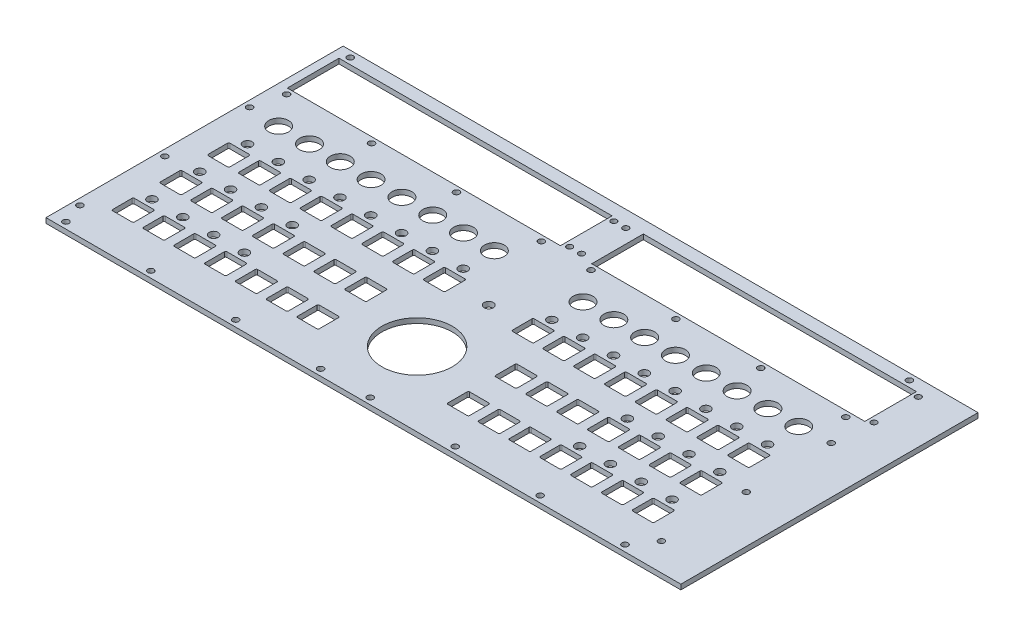
from build123d import *

# Parameters (mm, degrees)
SKETCH1_W              = 379.857
SKETCH1_H              = 177.8
BOSS_EXTRUDE1_DEPTH    = 2.999994
SKETCH2_R              = 5.92074
SKETCH2_W              = 163.40074
SKETCH2_H              = 30.8991
CUT_EXTRUDE1_DEPTH     = 10.16
CUT_EXTRUDE2_DEPTH     = 50.8
SKETCH6_R              = 2.667
CUT_EXTRUDE3_DEPTH     = 50.8
LPATTERN1_COUNT        = 8
LPATTERN1_PITCH        = 18.4375044
LPATTERN1_COUNT_DIR2   = 3
LPATTERN1_PITCH_DIR2   = 28.575
LPATTERN2_COUNT        = 8
LPATTERN2_PITCH        = 18.4375044
LPATTERN2_COUNT_DIR2   = 3
LPATTERN2_PITCH_DIR2   = 28.575
SKETCH7_W              = 12.9999994
SKETCH7_H              = 12.9999994
CUT_EXTRUDE4_DEPTH     = 5.08
FILLET1_R              = 0.7493
FILLET2_R              = 0.7493
LPATTERN3_COUNT        = 8
LPATTERN3_PITCH        = 18.4375044
LPATTERN3_COUNT_DIR2   = 3
LPATTERN3_PITCH_DIR2   = 28.575
FILLET1_OF_LPATTERN3_R = 0.7493
FILLET2_OF_LPATTERN3_R = 0.7493
SKETCH9_R              = 21.06168
CUT_EXTRUDE6_DEPTH     = 5.08
SKETCH10_R             = 2.667
CUT_EXTRUDE7_DEPTH     = 5.08
LPATTERN4_COUNT        = 8
LPATTERN4_PITCH        = 18.4375044
LPATTERN4_COUNT_DIR2   = 3
LPATTERN4_PITCH_DIR2   = 28.575
SKETCH11_R             = 2.7499945
CUT_EXTRUDE8_DEPTH     = 5.08
SKETCH12_R             = 1.8288
CUT_EXTRUDE9_DEPTH     = 5.08
LPATTERN5_COUNT        = 4
LPATTERN5_PITCH        = 50.8
SKETCH13_R             = 1.8288
CUT_EXTRUDE10_DEPTH    = 5.08
LPATTERN6_COUNT        = 4
LPATTERN6_PITCH        = 50.8
LPATTERN6_COUNT_DIR2   = 2
LPATTERN6_PITCH_DIR2   = 38.1
SKETCH14_R             = 1.8288
CUT_EXTRUDE11_DEPTH    = 5.08
LPATTERN7_COUNT        = 3
LPATTERN7_PITCH        = 50.8
SKETCH15_R             = 1.8288
CUT_EXTRUDE12_DEPTH    = 5.08
LPATTERN8_COUNT        = 4
LPATTERN8_PITCH        = 50.8
SKETCH16_R             = 1.8288
CUT_EXTRUDE13_DEPTH    = 5.08
LPATTERN9_COUNT        = 4
LPATTERN9_PITCH        = 50.8
LPATTERN9_COUNT_DIR2   = 2
LPATTERN9_PITCH_DIR2   = 38.1
SKETCH17_R             = 1.8288
CUT_EXTRUDE14_DEPTH    = 5.08
LPATTERN10_COUNT       = 3
LPATTERN10_PITCH       = 50.8
SKETCH19_R             = 1.75
SKETCH19_R_2           = 1.7292972
SKETCH19_R_3           = 1.725593959
CUT_EXTRUDE15_DEPTH    = 10


with BuildPart() as part:
    # Sketch1 → Boss-Extrude1 (new body)
    with BuildSketch(Plane(origin=(0, 0, 0), x_dir=(1, 0, 0), z_dir=(0, 1, 0))):
        with Locations((148.119960524, -55.488902214)):
            Rectangle(SKETCH1_W, SKETCH1_H)
    extrude(amount=BOSS_EXTRUDE1_DEPTH)

    # Sketch2 → Cut-Extrude1 (cut)
    with BuildSketch(Plane(origin=(0, 2.999994, 0), x_dir=(1, 0, 0), z_dir=(0, 1, 0))):
        with Locations(Location((-19.596239476, -27.399042214, 0), (0, 0, 270))):
            Circle(SKETCH2_R)
        with Locations(Location((-1.158379476, -27.399042214, 0), (0, 0, 270))):
            Circle(SKETCH2_R)
        with Locations(Location((17.279480524, -27.399042214, 0), (0, 0, 270))):
            Circle(SKETCH2_R)
        with Locations(Location((35.717340524, -27.399042214, 0), (0, 0, 270))):
            Circle(SKETCH2_R)
        with Locations(Location((54.155200524, -27.399042214, 0), (0, 0, 270))):
            Circle(SKETCH2_R)
        with Locations(Location((72.593060524, -27.399042214, 0), (0, 0, 270))):
            Circle(SKETCH2_R)
        with Locations(Location((91.030920524, -27.399042214, 0), (0, 0, 270))):
            Circle(SKETCH2_R)
        with Locations(Location((109.468780524, -27.399042214, 0), (0, 0, 270))):
            Circle(SKETCH2_R)
        with Locations(Location((291.586780524, -27.399042214, 0), (0, 0, 270))):
            Circle(SKETCH2_R)
        with Locations(Location((273.148920524, -27.399042214, 0), (0, 0, 270))):
            Circle(SKETCH2_R)
        with Locations(Location((254.711060524, -27.399042214, 0), (0, 0, 270))):
            Circle(SKETCH2_R)
        with Locations(Location((236.273200524, -27.399042214, 0), (0, 0, 270))):
            Circle(SKETCH2_R)
        with Locations(Location((217.835340524, -27.399042214, 0), (0, 0, 270))):
            Circle(SKETCH2_R)
        with Locations(Location((199.397480524, -27.399042214, 0), (0, 0, 270))):
            Circle(SKETCH2_R)
        with Locations(Location((180.959620524, -27.399042214, 0), (0, 0, 270))):
            Circle(SKETCH2_R)
        with Locations(Location((162.521760524, -27.399042214, 0), (0, 0, 270))):
            Circle(SKETCH2_R)
        with Locations((44.932968524, 10.422827786)):
            Rectangle(SKETCH2_W, SKETCH2_H)
        with Locations((227.050968524, 10.422827786)):
            Rectangle(SKETCH2_W, SKETCH2_H)
    extrude(amount=-CUT_EXTRUDE1_DEPTH, mode=Mode.SUBTRACT)

    # Sketch4 → Cut-Extrude2 (cut)
    with BuildSketch(Plane(origin=(0, 2.999994, 0), x_dir=(1, 0, 0), z_dir=(0, 1, 0))):
        with BuildLine():
            Line((-25.346238136, -50.779602514), (-13.846240816, -50.779602514))
            ThreePointArc((-13.846240816, -50.779602514), (-13.315909995, -50.999272732), (-13.096239776, -51.529603554))
            Line((-13.096239776, -51.529603554), (-13.096239776, -63.029600874))
            ThreePointArc((-13.096239776, -63.029600874), (-13.315909995, -63.559931695), (-13.846240816, -63.779601914))
            Line((-13.846240816, -63.779601914), (-25.346238136, -63.779601914))
            ThreePointArc((-25.346238136, -63.779601914), (-25.876568957, -63.559931695), (-26.096239176, -63.029600874))
            Line((-26.096239176, -63.029600874), (-26.096239176, -51.529603554))
            ThreePointArc((-26.096239176, -51.529603554), (-25.876568957, -50.999272732), (-25.346238136, -50.779602514))
        make_face()
    cut_extrude2 = extrude(amount=-CUT_EXTRUDE2_DEPTH, mode=Mode.SUBTRACT)

    # Sketch6 → Cut-Extrude3 (cut)
    with BuildSketch(Plane(origin=(0, 2.999994, 0), x_dir=(1, 0, 0), z_dir=(0, 1, 0))):
        with Locations(Location((-19.596239476, -46.040102214, 0), (0, 0, 270))):
            Circle(SKETCH6_R)
    cut_extrude3 = extrude(amount=-CUT_EXTRUDE3_DEPTH, mode=Mode.SUBTRACT)

    # LPattern1: Cut-Extrude3 8 × 3, 8 skipped
    with Locations(*[(i * LPATTERN1_PITCH, 0, j * LPATTERN1_PITCH_DIR2) for i in range(LPATTERN1_COUNT) for j in range(LPATTERN1_COUNT_DIR2) if (i, j) not in ((0, 0), (4, 1), (4, 2), (5, 1), (5, 2), (6, 1), (6, 2), (7, 1), (7, 2))]):
        add(cut_extrude3, mode=Mode.SUBTRACT)

    # LPattern2: Cut-Extrude2 8 × 3, 2 skipped
    with Locations(*[(i * LPATTERN2_PITCH, 0, j * LPATTERN2_PITCH_DIR2) for i in range(LPATTERN2_COUNT) for j in range(LPATTERN2_COUNT_DIR2) if (i, j) not in ((0, 0), (7, 1), (7, 2))]):
        add(cut_extrude2, mode=Mode.SUBTRACT)

    # Sketch7 → Cut-Extrude4 (cut)
    with BuildSketch(Plane(origin=(0, 2.999994, 0), x_dir=(1, 0, 0), z_dir=(0, 1, 0))):
        with Locations((291.586780524, -57.279741914)):
            Rectangle(SKETCH7_W, SKETCH7_H)
    cut_extrude4 = extrude(amount=-CUT_EXTRUDE4_DEPTH, mode=Mode.SUBTRACT)

    # Fillet1
    fillet1_edges = [part.edges().sort_by_distance(p)[0] for p in [
        (285.086780824, 1.499997, 50.779742214),
    ]]
    fillet(fillet1_edges, radius=FILLET1_R)

    # Fillet2
    fillet2_edges = [part.edges().sort_by_distance(p)[0] for p in [
        (285.086780824, 1.499997, 63.779741614),
        (298.086780224, 1.499997, 50.779742214),
        (298.086780224, 1.499997, 63.779741614),
    ]]
    fillet(fillet2_edges, radius=FILLET2_R)

    # LPattern3: Cut-Extrude4 8 × 3, 2 skipped
    with Locations(*[(-i * LPATTERN3_PITCH, 0, j * LPATTERN3_PITCH_DIR2) for i in range(LPATTERN3_COUNT) for j in range(LPATTERN3_COUNT_DIR2) if (i, j) not in ((0, 0), (7, 1), (7, 2))]):
        add(cut_extrude4, mode=Mode.SUBTRACT)

    # Fillet1 of LPattern3
    fillet1_of_lpattern3_edges = [part.edges().sort_by_distance(p)[0] for p in [
        (285.086780824, 1.499997, 79.354742214),
        (285.086780824, 1.499997, 107.929742214),
        (266.649276424, 1.499997, 50.779742214),
        (266.649276424, 1.499997, 79.354742214),
        (266.649276424, 1.499997, 107.929742214),
        (248.211772024, 1.499997, 50.779742214),
        (248.211772024, 1.499997, 79.354742214),
        (248.211772024, 1.499997, 107.929742214),
        (229.774267624, 1.499997, 50.779742214),
        (229.774267624, 1.499997, 79.354742214),
        (229.774267624, 1.499997, 107.929742214),
        (211.336763224, 1.499997, 50.779742214),
        (211.336763224, 1.499997, 79.354742214),
        (211.336763224, 1.499997, 107.929742214),
        (192.899258824, 1.499997, 50.779742214),
        (192.899258824, 1.499997, 79.354742214),
        (192.899258824, 1.499997, 107.929742214),
        (174.461754424, 1.499997, 50.779742214),
        (174.461754424, 1.499997, 79.354742214),
        (174.461754424, 1.499997, 107.929742214),
        (156.024250024, 1.499997, 50.779742214),
    ]]
    fillet(fillet1_of_lpattern3_edges, radius=FILLET1_OF_LPATTERN3_R)

    # Fillet2 of LPattern3
    fillet2_of_lpattern3_edges = [part.edges().sort_by_distance(p)[0] for p in [
        (285.086780824, 1.499997, 92.354741614),
        (298.086780224, 1.499997, 79.354742214),
        (298.086780224, 1.499997, 92.354741614),
        (285.086780824, 1.499997, 120.929741614),
        (298.086780224, 1.499997, 107.929742214),
        (298.086780224, 1.499997, 120.929741614),
        (266.649276424, 1.499997, 63.779741614),
        (279.649275824, 1.499997, 50.779742214),
        (279.649275824, 1.499997, 63.779741614),
        (266.649276424, 1.499997, 92.354741614),
        (279.649275824, 1.499997, 79.354742214),
        (279.649275824, 1.499997, 92.354741614),
        (266.649276424, 1.499997, 120.929741614),
        (279.649275824, 1.499997, 107.929742214),
        (279.649275824, 1.499997, 120.929741614),
        (248.211772024, 1.499997, 63.779741614),
        (261.211771424, 1.499997, 50.779742214),
        (261.211771424, 1.499997, 63.779741614),
        (248.211772024, 1.499997, 92.354741614),
        (261.211771424, 1.499997, 79.354742214),
        (261.211771424, 1.499997, 92.354741614),
        (248.211772024, 1.499997, 120.929741614),
        (261.211771424, 1.499997, 107.929742214),
        (261.211771424, 1.499997, 120.929741614),
        (229.774267624, 1.499997, 63.779741614),
        (242.774267024, 1.499997, 50.779742214),
        (242.774267024, 1.499997, 63.779741614),
        (229.774267624, 1.499997, 92.354741614),
        (242.774267024, 1.499997, 79.354742214),
        (242.774267024, 1.499997, 92.354741614),
        (229.774267624, 1.499997, 120.929741614),
        (242.774267024, 1.499997, 107.929742214),
        (242.774267024, 1.499997, 120.929741614),
        (211.336763224, 1.499997, 63.779741614),
        (224.336762624, 1.499997, 50.779742214),
        (224.336762624, 1.499997, 63.779741614),
        (211.336763224, 1.499997, 92.354741614),
        (224.336762624, 1.499997, 79.354742214),
        (224.336762624, 1.499997, 92.354741614),
        (211.336763224, 1.499997, 120.929741614),
        (224.336762624, 1.499997, 107.929742214),
        (224.336762624, 1.499997, 120.929741614),
        (192.899258824, 1.499997, 63.779741614),
        (205.899258224, 1.499997, 50.779742214),
        (205.899258224, 1.499997, 63.779741614),
        (192.899258824, 1.499997, 92.354741614),
        (205.899258224, 1.499997, 79.354742214),
        (205.899258224, 1.499997, 92.354741614),
        (192.899258824, 1.499997, 120.929741614),
        (205.899258224, 1.499997, 107.929742214),
        (205.899258224, 1.499997, 120.929741614),
        (174.461754424, 1.499997, 63.779741614),
        (187.461753824, 1.499997, 50.779742214),
        (187.461753824, 1.499997, 63.779741614),
        (174.461754424, 1.499997, 92.354741614),
        (187.461753824, 1.499997, 79.354742214),
        (187.461753824, 1.499997, 92.354741614),
        (174.461754424, 1.499997, 120.929741614),
        (187.461753824, 1.499997, 107.929742214),
        (187.461753824, 1.499997, 120.929741614),
        (156.024250024, 1.499997, 63.779741614),
        (169.024249424, 1.499997, 50.779742214),
        (169.024249424, 1.499997, 63.779741614),
    ]]
    fillet(fillet2_of_lpattern3_edges, radius=FILLET2_OF_LPATTERN3_R)

    # Sketch9 → Cut-Extrude6 (cut)
    with BuildSketch(Plane(origin=(0, 2.999994, 0), x_dir=(1, 0, 0), z_dir=(0, 1, 0))):
        with Locations(Location((135.994724424, -100.142241914, 0), (0, 0, 270))):
            Circle(SKETCH9_R)
    extrude(amount=-CUT_EXTRUDE6_DEPTH, mode=Mode.SUBTRACT)

    # Sketch10 → Cut-Extrude7 (cut)
    with BuildSketch(Plane(origin=(0, 2.999994, 0), x_dir=(1, 0, 0), z_dir=(0, 1, 0))):
        with Locations(Location((291.586780524, -46.040102214, 0), (0, 0, 270))):
            Circle(SKETCH10_R)
    cut_extrude7 = extrude(amount=-CUT_EXTRUDE7_DEPTH, mode=Mode.SUBTRACT)

    # LPattern4: Cut-Extrude7 8 × 3, 8 skipped
    with Locations(*[(-i * LPATTERN4_PITCH, 0, j * LPATTERN4_PITCH_DIR2) for i in range(LPATTERN4_COUNT) for j in range(LPATTERN4_COUNT_DIR2) if (i, j) not in ((0, 0), (4, 1), (4, 2), (5, 1), (5, 2), (6, 1), (6, 2), (7, 1), (7, 2))]):
        add(cut_extrude7, mode=Mode.SUBTRACT)

    # Sketch11 → Cut-Extrude8 (cut)
    with BuildSketch(Plane(origin=(0, 2.999994, 0), x_dir=(1, 0, 0), z_dir=(0, 1, 0))):
        with Locations(Location((135.995080024, -57.279741914, 0), (0, 0, 270))):
            Circle(SKETCH11_R)
    extrude(amount=-CUT_EXTRUDE8_DEPTH, mode=Mode.SUBTRACT)

    # Sketch12 → Cut-Extrude9 (cut)
    with BuildSketch(Plane(origin=(0, 2.999994, 0), x_dir=(1, 0, 0), z_dir=(0, 1, 0))):
        with Locations(Location((-33.708479476, -140.578902214, 0), (0, 0, 270))):
            Circle(SKETCH12_R)
    cut_extrude9 = extrude(amount=-CUT_EXTRUDE9_DEPTH, mode=Mode.SUBTRACT)

    # LPattern5: Cut-Extrude9 ×4
    with Locations(*[(i * LPATTERN5_PITCH, 0, 0) for i in range(1, LPATTERN5_COUNT)]):
        add(cut_extrude9, mode=Mode.SUBTRACT)

    # Sketch13 → Cut-Extrude10 (cut)
    with BuildSketch(Plane(origin=(0, 2.999994, 0), x_dir=(1, 0, 0), z_dir=(0, 1, 0))):
        with Locations(Location((-33.708479476, 29.601097786, 0), (0, 0, 270))):
            Circle(SKETCH13_R)
    cut_extrude10 = extrude(amount=-CUT_EXTRUDE10_DEPTH, mode=Mode.SUBTRACT)

    # LPattern6: Cut-Extrude10 4 × 2, 3 skipped
    with Locations(*[(i * LPATTERN6_PITCH, 0, j * LPATTERN6_PITCH_DIR2) for i in range(LPATTERN6_COUNT) for j in range(LPATTERN6_COUNT_DIR2) if (i, j) not in ((0, 0), (1, 0), (2, 0), (3, 0))]):
        add(cut_extrude10, mode=Mode.SUBTRACT)

    # Sketch14 → Cut-Extrude11 (cut)
    with BuildSketch(Plane(origin=(0, 2.999994, 0), x_dir=(1, 0, 0), z_dir=(0, 1, 0))):
        with Locations(Location((-38.056959476, -127.878902214, 0), (0, 0, 270))):
            Circle(SKETCH14_R)
    cut_extrude11 = extrude(amount=-CUT_EXTRUDE11_DEPTH, mode=Mode.SUBTRACT)

    # LPattern7: Cut-Extrude11 ×3
    with Locations(*[(0, 0, -i * LPATTERN7_PITCH) for i in range(1, LPATTERN7_COUNT)]):
        add(cut_extrude11, mode=Mode.SUBTRACT)

    # Sketch15 → Cut-Extrude12 (cut)
    with BuildSketch(Plane(origin=(0, 2.999994, 0), x_dir=(1, 0, 0), z_dir=(0, 1, 0))):
        with Locations(Location((300.809520524, -140.578902214, 0), (0, 0, 270))):
            Circle(SKETCH15_R)
    cut_extrude12 = extrude(amount=-CUT_EXTRUDE12_DEPTH, mode=Mode.SUBTRACT)

    # LPattern8: Cut-Extrude12 ×4
    with Locations(*[(-i * LPATTERN8_PITCH, 0, 0) for i in range(1, LPATTERN8_COUNT)]):
        add(cut_extrude12, mode=Mode.SUBTRACT)

    # Sketch16 → Cut-Extrude13 (cut)
    with BuildSketch(Plane(origin=(0, 2.999994, 0), x_dir=(1, 0, 0), z_dir=(0, 1, 0))):
        with Locations(Location((300.809520524, 29.601097786, 0), (0, 0, 270))):
            Circle(SKETCH16_R)
    cut_extrude13 = extrude(amount=-CUT_EXTRUDE13_DEPTH, mode=Mode.SUBTRACT)

    # LPattern9: Cut-Extrude13 4 × 2, 3 skipped
    with Locations(*[(-i * LPATTERN9_PITCH, 0, j * LPATTERN9_PITCH_DIR2) for i in range(LPATTERN9_COUNT) for j in range(LPATTERN9_COUNT_DIR2) if (i, j) not in ((0, 0), (1, 0), (2, 0), (3, 0))]):
        add(cut_extrude13, mode=Mode.SUBTRACT)

    # Sketch17 → Cut-Extrude14 (cut)
    with BuildSketch(Plane(origin=(0, 2.999994, 0), x_dir=(1, 0, 0), z_dir=(0, 1, 0))):
        with Locations(Location((309.923040524, -127.878902214, 0), (0, 0, 270))):
            Circle(SKETCH17_R)
    cut_extrude14 = extrude(amount=-CUT_EXTRUDE14_DEPTH, mode=Mode.SUBTRACT)

    # LPattern10: Cut-Extrude14 ×3
    with Locations(*[(0, 0, -i * LPATTERN10_PITCH) for i in range(1, LPATTERN10_COUNT)]):
        add(cut_extrude14, mode=Mode.SUBTRACT)

    # Sketch19 → Cut-Extrude15 (cut)
    with BuildSketch(Plane.XZ):
        with Locations(Location((312.050968524, -23.672737786, 0), (0, 0, 270))):
            Circle(SKETCH19_R)
        with Locations(Location((312.050968524, 2.827262214, 0), (0, 0, 270))):
            Circle(SKETCH19_R)
        with Locations(Location((137.050968524, -23.672737786, 0), (0, 0, 270))):
            Circle(SKETCH19_R)
        with Locations(Location((137.050968524, 2.827262214, 0), (0, 0, 270))):
            Circle(SKETCH19_R)
        with Locations(Location((129.93163256, 2.806602564, 0), (0, 0, 270))):
            Circle(SKETCH19_R_2)
        with Locations(Location((129.90980251, -23.665057251, 0), (0, 0, 270))):
            Circle(SKETCH19_R_3)
    extrude(amount=-CUT_EXTRUDE15_DEPTH, mode=Mode.SUBTRACT)


solid = part.part
